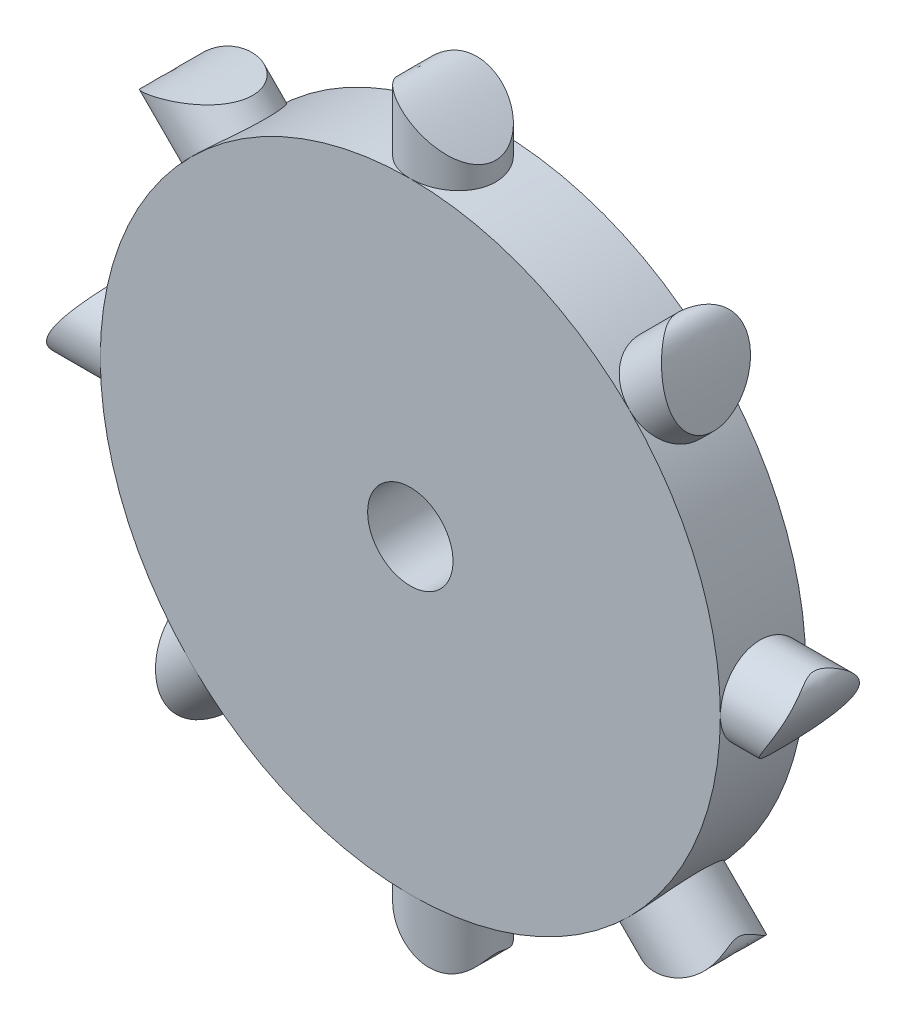
from build123d import *
from build123d.topology import SkipClean

# Parameters (mm, degrees)
SKETCH1_R           = 27.669253018
BOSS_EXTRUDE1_DEPTH = 7.62
CUT_EXTRUDE2_REACH  = 41.865
SKETCH3_R           = 3.81
BOSS_EXTRUDE3_REACH = 69.133
SKETCH4_R           = 3.81
CUT_EXTRUDE3_DEPTH  = 10.16
CIRPATTERN1_COUNT   = 8


with BuildPart() as part:
    # Sketch1 → Boss-Extrude1 (new body)
    with BuildSketch(Plane.XY):
        Circle(SKETCH1_R)
    extrude(amount=BOSS_EXTRUDE1_DEPTH)

    # Sketch3 → Cut-Extrude2 (cut, up to next)
    with BuildSketch(Plane(origin=(0, 0, 0), x_dir=(-1, 0, 0), z_dir=(0, 0, -1)), mode=Mode.PRIVATE) as cut_extrude2_sk1:
        Circle(SKETCH3_R)
    cut_extrude2_tool1 = extrude(cut_extrude2_sk1.sketch, amount=-CUT_EXTRUDE2_REACH, mode=Mode.PRIVATE) & part.part
    add(cut_extrude2_tool1.solids().sort_by_distance((0, 0, 0))[0], mode=Mode.SUBTRACT)

    # Sketch4 → Boss-Extrude3 (add, up to next)
    with BuildSketch(Plane(origin=(0, 33.02, 0), x_dir=(1, 0, 0), z_dir=(0, 1, 0)), mode=Mode.PRIVATE) as boss_extrude3_sk1:
        with Locations((0, -3.81)):
            Circle(SKETCH4_R)
    boss_extrude3_tool1 = extrude(boss_extrude3_sk1.sketch, amount=-BOSS_EXTRUDE3_REACH, mode=Mode.PRIVATE) - part.part
    boss_extrude3 = boss_extrude3_tool1.solids().sort_by_distance((0, 33.02, 3.81))[0]
    add(boss_extrude3)

    # Sketch6 → Cut-Extrude3 (cut)
    with SkipClean():  # the faces are left unmerged after this step: merging them gives an invalid solid
        with BuildSketch(Plane(origin=(0, 0, 0), x_dir=(-1, 0, 0), z_dir=(0, 0, -1))):
            with BuildLine():
                Line((4.330992326, 33.667164239), (-4.203419182, 33.667164239))
                Line((-4.203419182, 33.667164239), (-4.203419182, 28.739889621))
                add(Edge.make_bspline(
                    [(-4.203419182, 28.739889621), (5.405318302, 37.278438255), (3.81, 28.739889621)],
                    knots=[0, 0, 0, 1, 1, 1], degree=2))
                Line((3.81, 28.739889621), (4.330992326, 28.739889621))
                Line((4.330992326, 28.739889621), (4.330992326, 33.667164239))
            make_face()
        cut_extrude3 = extrude(amount=-CUT_EXTRUDE3_DEPTH, mode=Mode.SUBTRACT)

    # CirPattern1: Boss-Extrude3, Cut-Extrude3 ×8 about axis
    cirpattern1_axis = Axis((0, 0, 7.62), (0, 0, -1))
    add([boss_extrude3.rotate(cirpattern1_axis, i * 360 / CIRPATTERN1_COUNT) for i in range(1, CIRPATTERN1_COUNT)])
    add([cut_extrude3.rotate(cirpattern1_axis, i * 360 / CIRPATTERN1_COUNT) for i in range(1, CIRPATTERN1_COUNT)], mode=Mode.SUBTRACT)


solid = part.part
